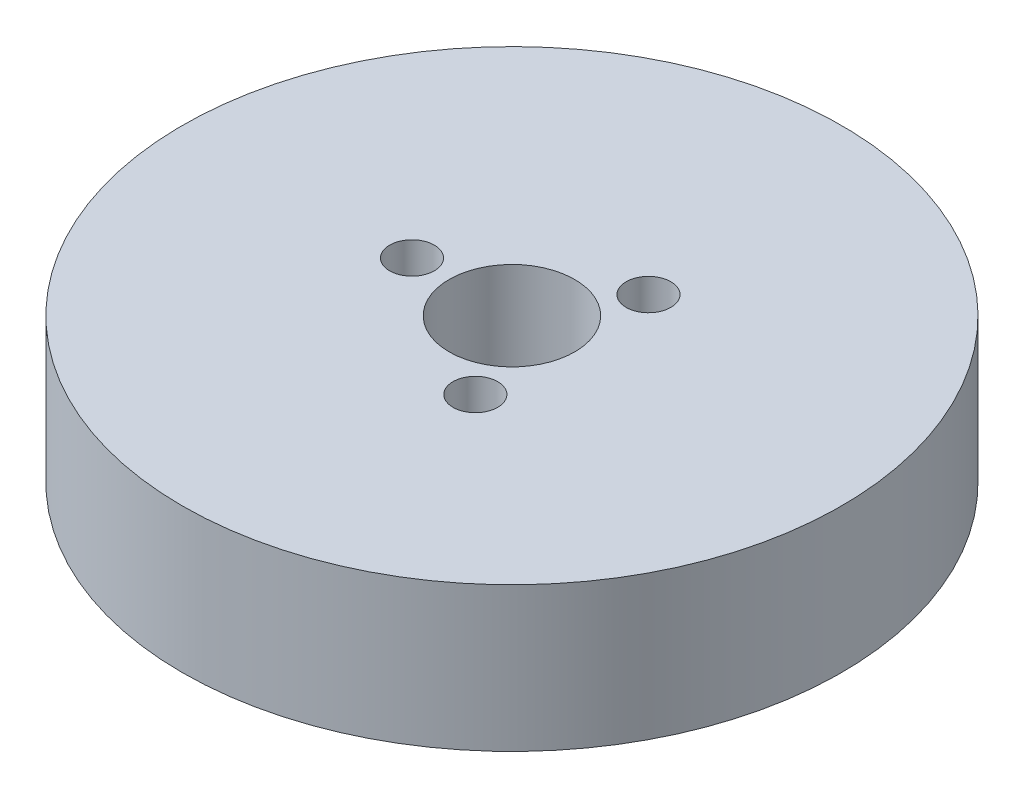
from build123d import *

# Parameters (mm, degrees)
SKETCH1_R           = 52.5
BOSS_EXTRUDE1_DEPTH = 23
SKETCH2_R           = 10
CUT_EXTRUDE1_DEPTH  = 78.727086656
SKETCH3_R           = 3.556020506
CUT_EXTRUDE2_DEPTH  = 13.80204795
CIRPATTERN1_COUNT   = 3


with BuildPart() as part:
    # Sketch1 → Boss-Extrude1 (new body)
    with BuildSketch(Plane(origin=(0, 0, 0), x_dir=(1, 0, 0), z_dir=(0, 1, 0))):
        Circle(SKETCH1_R)
    extrude(amount=BOSS_EXTRUDE1_DEPTH)

    # Sketch2 → Cut-Extrude1 (cut, through all)
    with BuildSketch(Plane(origin=(0, 0, 0), x_dir=(1, 0, 0), z_dir=(0, 1, 0))):
        Circle(SKETCH2_R)
    extrude(amount=CUT_EXTRUDE1_DEPTH, mode=Mode.SUBTRACT)

    # Sketch3 → Cut-Extrude2 (cut)
    with BuildSketch(Plane(origin=(0, 23, 0), x_dir=(1, 0, 0), z_dir=(0, 1, 0))):
        with Locations((-15.922442836, 0)):
            Circle(SKETCH3_R)
    cut_extrude2 = extrude(amount=-CUT_EXTRUDE2_DEPTH, mode=Mode.SUBTRACT)

    # CirPattern1: Cut-Extrude2 ×3 about axis
    cirpattern1_axis = Axis((0, 0, 0), (0, 1, 0))
    for i in range(1, CIRPATTERN1_COUNT):
        add(cut_extrude2.rotate(cirpattern1_axis, i * 360 / CIRPATTERN1_COUNT), mode=Mode.SUBTRACT)


solid = part.part
